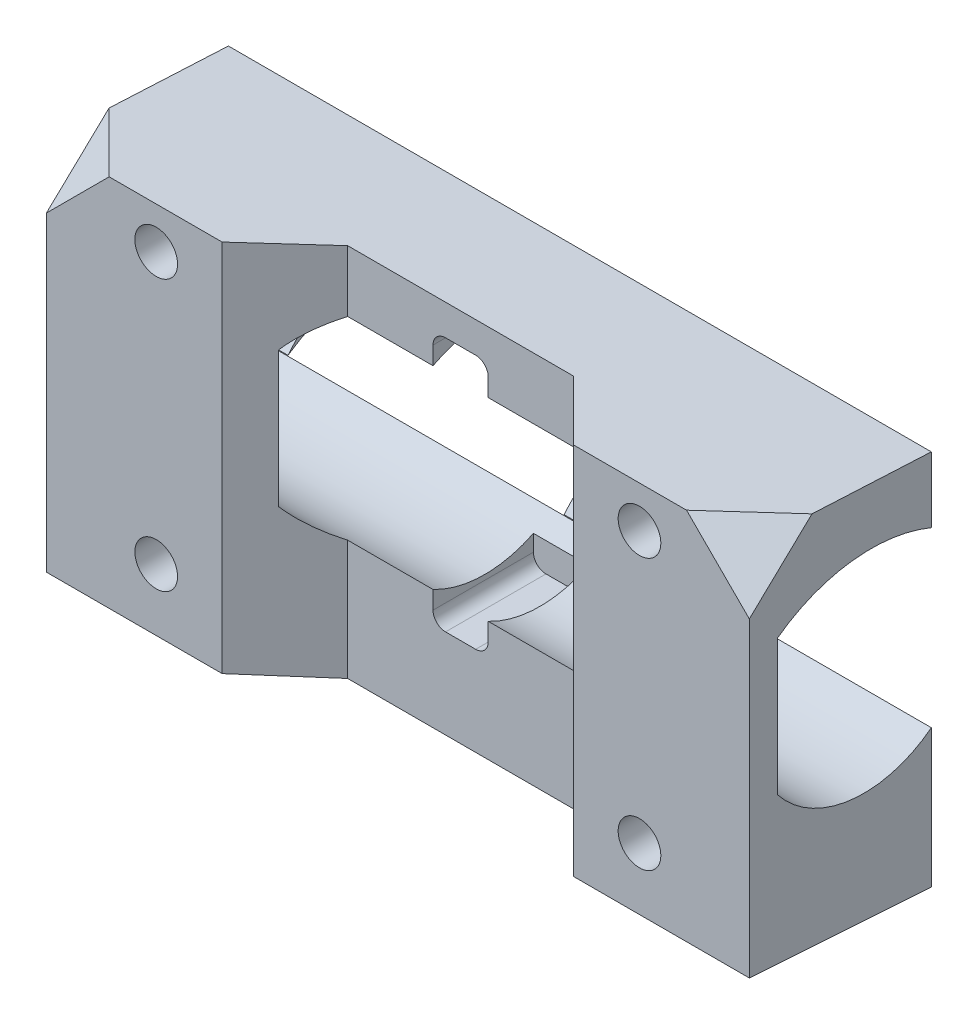
from build123d import *

# Parameters (mm, degrees)
ESBO_O1_W                        = 56
ESBO_O1_H                        = 28.051471863
RESSALTO_EXTRUS_O1_DEPTH         = 16
CORTE_EXTRUS_O1_DEPTH            = 100
ESBO_O3_W                        = 18
ESBO_O3_H                        = 28.051471863
CORTE_EXTRUS_O2_DEPTH            = 5
FURO_COM_FOLGA_DE_M32_D          = 3.4
FURO_COM_FOLGA_DE_M34_D          = 3.4
CHANFRO1_SIZE                    = 5
CORTE_EXTRUS_O3_DEPTH            = 8
RESSALTO_EXTRUS_O3_DEPTH         = 56
CORTE_EXTRUS_O4_DEPTH            = 100
CHANFRO2_START                   = 38.631741411
CHANFRO2_OUTLINE_W               = 9
CHANFRO2_OUTLINE_H               = 10
CHANFRO2_DEPTH                   = 4.368258589
CHANFRO3_START                   = -67
CHANFRO3_OUTLINE_W               = 9
CHANFRO3_OUTLINE_H               = 10
CHANFRO3_DEPTH                   = 3.439248526
RESSALTO_EXTRUS_O4_DEPTH         = 2
CORTE_EXTRUS_O5_DEPTH            = 100
CORTE_EXTRUS_O6_START            = -56
ESBO_O24_W                       = 1.5
ESBO_O24_H                       = 30.126471863
CORTE_EXTRUS_O6_DEPTH            = 56
RESSALTO_EXTRUS_O6_DEPTH         = 17
RESSALTO_EXTRUS_O7_START         = -17
RESSALTO_EXTRUS_O7_DEPTH         = 17
ESBO_O29_R                       = 1.7
CORTE_EXTRUS_O16_DEPTH           = 17
CORTE_EXTRUS_O16_DRAFT           = -0.2
CORTE_EXTRUS_O16_PROFILE_2_DEPTH = 17
CORTE_EXTRUS_O16_PROFILE_2_DRAFT = -0.2


with BuildPart() as part:
    # Esboço1 → Ressalto-extrusão1 (new body)
    with BuildSketch(Plane.XY):
        with Locations((-21.244121058, 34.04115584)):
            Rectangle(ESBO_O1_W, ESBO_O1_H)
    extrude(amount=RESSALTO_EXTRUS_O1_DEPTH)

    # Esboço2 → Corte-extrusão1 (cut)
    with BuildSketch(Plane(origin=(6.755878942, 0, 0), x_dir=(0, 0, -1), z_dir=(1, 0, 0))):
        with BuildLine():
            Line((0, 41.428078682), (0, 30.602761135))
            ThreePointArc((0, 30.602761135), (-6.875, 27.265419908), (-13.75, 30.602761135))
            Line((-13.75, 30.602761135), (-13.75, 41.428078682))
            ThreePointArc((-13.75, 41.428078682), (-6.875, 44.765419908), (0, 41.428078682))
        make_face()
    extrude(amount=-CORTE_EXTRUS_O1_DEPTH, mode=Mode.SUBTRACT)

    # Esboço3 → Corte-extrusão2 (cut)
    with BuildSketch(Plane.XY.offset(16)):
        with Locations((-21.244121058, 34.04115584)):
            Rectangle(ESBO_O3_W, ESBO_O3_H)
    extrude(amount=-CORTE_EXTRUS_O2_DEPTH, mode=Mode.SUBTRACT)

    # Furo com folga de M32 (through all)
    with Locations(Plane.XY.offset(16)):
        with Locations((-1.994121058, 45.566891771), (-40.494121058, 45.566891771)):
            Hole(FURO_COM_FOLGA_DE_M32_D / 2)

    # Furo com folga de M34 (through all)
    with Locations(Plane.XY.offset(16)):
        with Locations((-1.994121058, 24.015419908), (-40.494121058, 24.015419908)):
            Hole(FURO_COM_FOLGA_DE_M34_D / 2)

    # Chanfro1
    # the kernel refuses this chamfer: 5 mm, written as the material it takes off along each edge
    with BuildSketch(Plane(origin=(-12.244121058, 7.157004969, 16), x_dir=(1, 0, 0), z_dir=(0, 1, 0))) as chanfro1_piece_1:
        Polygon((CHANFRO1_SIZE, 0), (0, CHANFRO1_SIZE), (0, 0), align=None)
    extrude(amount=53.768301742, mode=Mode.SUBTRACT)
    with BuildSketch(Plane(origin=(-30.244121058, 60.925306711, 16), x_dir=(0, 0, -1), z_dir=(0, -1, 0))) as chanfro1_piece_2:
        Polygon((CHANFRO1_SIZE, 0), (0, -CHANFRO1_SIZE), (0, 0), align=None)
    extrude(amount=53.768301742, mode=Mode.SUBTRACT)

    # Esboço17 → Corte-extrusão3 (cut)
    with BuildSketch(Plane.XY.offset(11)):
        with BuildLine():
            Line((-20.044121058, 25.869616944), (-22.444121058, 25.869616944))
            ThreePointArc((-22.444121058, 25.869616944), (-23.151227839, 26.162510163), (-23.444121058, 26.869616944))
            Line((-23.444121058, 26.869616944), (-23.444121058, 27.069616944))
            Line((-23.444121058, 27.069616944), (-23.444121058, 44.959616944))
            Line((-23.444121058, 44.959616944), (-23.444121058, 45.159616944))
            ThreePointArc((-23.444121058, 45.159616944), (-23.151227839, 45.866723726), (-22.444121058, 46.159616944))
            Line((-22.444121058, 46.159616944), (-20.044121058, 46.159616944))
            ThreePointArc((-20.044121058, 46.159616944), (-19.337014277, 45.866723726), (-19.044121058, 45.159616944))
            Line((-19.044121058, 45.159616944), (-19.044121058, 43.159616944))
            Line((-19.044121058, 43.159616944), (-19.044121058, 36.014616944))
            Line((-19.044121058, 36.014616944), (-19.044121058, 26.869616944))
            ThreePointArc((-19.044121058, 26.869616944), (-19.337014277, 26.162510163), (-20.044121058, 25.869616944))
        make_face()
    extrude(amount=-CORTE_EXTRUS_O3_DEPTH, mode=Mode.SUBTRACT)

    # Esboço20 → Ressalto-extrusão3 (add)
    with BuildSketch(Plane.ZY.offset(49.244121058)):
        Polygon((0, 48.066891771), (16, 48.066891771), (16, 48.866891771), align=None)
    extrude(amount=-RESSALTO_EXTRUS_O3_DEPTH)

    # Esboço21 → Corte-extrusão4 (cut)
    with BuildSketch(Plane.XZ.offset(-48.066891771)):
        Polygon((-7.244121058, 16), (-12.244121058, 11), (-30.244121058, 11), (-35.244121058, 16), align=None)
    extrude(amount=-CORTE_EXTRUS_O4_DEPTH, mode=Mode.SUBTRACT)

    # Chanfro2: read off the stored shape, not the designer's step
    # Chanfro2 outline → Chanfro2 (cut)
    with BuildSketch(Plane(origin=(0, 0, 0), x_dir=(0.8097846116702572, -0.42511166270745215, -0.4043871374464777), z_dir=(0.586727264324789, 0.58672726432479, 0.558123852380363)).offset(CHANFRO2_START)):
        with Locations((-22.5, 22)):
            Rectangle(CHANFRO2_OUTLINE_W, CHANFRO2_OUTLINE_H)
    extrude(amount=CHANFRO2_DEPTH, mode=Mode.SUBTRACT)

    # Chanfro3: read off the stored shape, not the designer's step
    # Chanfro3 outline → Chanfro3 (cut)
    with BuildSketch(Plane(origin=(0, 0, 0), x_dir=(0.8097846116702566, 0.4251116627074525, 0.404387137446478), z_dir=(0.5867272643247896, -0.5867272643247896, -0.5581238523803627)).offset(CHANFRO3_START)):
        with Locations((-11.5, -22)):
            Rectangle(CHANFRO3_OUTLINE_W, CHANFRO3_OUTLINE_H)
    extrude(amount=CHANFRO3_DEPTH, mode=Mode.SUBTRACT)

    # Esboço22 → Ressalto-extrusão4 (add)
    with BuildSketch(Plane.XZ.offset(-20.015419908)):
        Polygon((-49.244121058, 16), (-35.244121058, 16), (-30.244121058, 11), (-12.244121058, 11), (-7.244121058, 16), (6.755878942, 16), (6.755878942, 0), (-49.244121058, 0), align=None)
    extrude(amount=RESSALTO_EXTRUS_O4_DEPTH)

    # Esboço23 → Corte-extrusão5 (cut)
    with BuildSketch(Plane.ZY.offset(49.244121058)):
        Polygon((0, 18.015419908), (16, 19.091373139), (16, 18.015419908), align=None)
    extrude(amount=-CORTE_EXTRUS_O5_DEPTH, mode=Mode.SUBTRACT)

    # Esboço24 → Corte-extrusão6 (cut)
    with BuildSketch(Plane(origin=(6.755878942, 0, 0), x_dir=(0, 0, -1), z_dir=(1, 0, 0)).offset(CORTE_EXTRUS_O6_START)):
        with Locations((-0.75, 33.07865584)):
            Rectangle(ESBO_O24_W, ESBO_O24_H)
    extrude(amount=CORTE_EXTRUS_O6_DEPTH, mode=Mode.SUBTRACT)

    # Esboço26 → Ressalto-extrusão6 (add)
    with BuildSketch(Plane(origin=(6.755878942, 0, 0), x_dir=(0, 0, -1), z_dir=(1, 0, 0))):
        with BuildLine():
            ThreePointArc((-13.75, 41.428078682), (-7.807709843, 43.777058017), (-1.47808403, 42.902785008))
            ThreePointArc((-1.47808403, 42.902785008), (-7.918969725, 44.702918237), (-13.75, 41.428078682))
        make_face()
    extrude(amount=-RESSALTO_EXTRUS_O6_DEPTH)

    # Esboço28 → Ressalto-extrusão7 (add)
    with BuildSketch(Plane.ZY.offset(49.244121058).offset(RESSALTO_EXTRUS_O7_START)):
        with BuildLine():
            ThreePointArc((13.75, 41.428078682), (7.932773281, 44.701248348), (1.5, 42.919902148))
            ThreePointArc((1.5, 42.919902148), (7.808321968, 43.679325435), (13.75, 41.428078682))
        make_face()
    extrude(amount=RESSALTO_EXTRUS_O7_DEPTH)


with BuildPart() as corte_extrus_o16_tool:
    # Esboço29 → Corte-extrusão16 (with draft: the straight prism first)
    with BuildSketch(Plane.XY.offset(16)):
        with Locations((-40.494121058, 45.566891771)):
            Circle(ESBO_O29_R)
    extrude(amount=-CORTE_EXTRUS_O16_DEPTH)
    # Corte-extrusão16: the draft: its side faces are tilted about the plane it starts from
    corte_extrus_o16_sides = [corte_extrus_o16_tool.faces().sort_by_distance(p)[0] for p in [
        (-42.194121058, 45.566891771, 7.5),
    ]]
    draft(corte_extrus_o16_sides, Plane.XY.offset(16), CORTE_EXTRUS_O16_DRAFT)


with BuildPart() as part_1:
    add(part.part)

    # Corte-extrusão16: cut by corte_extrus_o16_tool
    add(corte_extrus_o16_tool.part, mode=Mode.SUBTRACT)


with BuildPart() as corte_extrus_o16_profile_2_tool:
    # Esboço29 → Corte-extrusão16 profile 2 (with draft: the straight prism first)
    with BuildSketch(Plane.XY.offset(16)):
        with Locations((-1.994121058, 45.566891771)):
            Circle(ESBO_O29_R)
    extrude(amount=-CORTE_EXTRUS_O16_PROFILE_2_DEPTH)
    # Corte-extrusão16 profile 2: the draft: its side faces are tilted about the plane it starts from
    corte_extrus_o16_profile_2_sides = [corte_extrus_o16_profile_2_tool.faces().sort_by_distance(p)[0] for p in [
        (-3.694121058, 45.566891771, 7.5),
    ]]
    draft(corte_extrus_o16_profile_2_sides, Plane.XY.offset(16), CORTE_EXTRUS_O16_PROFILE_2_DRAFT)


with BuildPart() as part_2:
    add(part_1.part)

    # Corte-extrusão16 profile 2: cut by corte_extrus_o16_profile_2_tool
    add(corte_extrus_o16_profile_2_tool.part, mode=Mode.SUBTRACT)


solid = part_2.part
